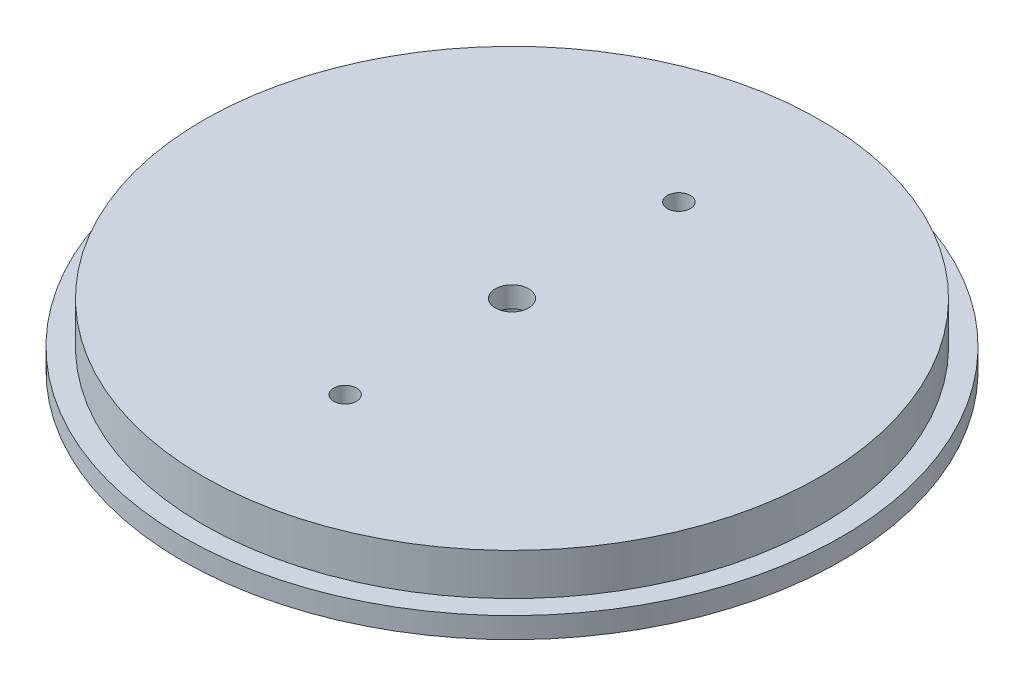
from build123d import *

# Parameters (mm, degrees)
SKETCH1_R           = 79
BOSS_EXTRUDE1_DEPTH = 5
SKETCH2_R           = 74
BOSS_EXTRUDE2_DEPTH = 10
SKETCH3_R           = 2.75
CUT_EXTRUDE1_DEPTH  = 113.725329895
SKETCH4_R           = 4
CUT_EXTRUDE2_DEPTH  = 5
SKETCH5_R           = 6
CUT_EXTRUDE3_DEPTH  = 10


with BuildPart() as part:
    # Sketch1 → Boss-Extrude1 (new body)
    with BuildSketch(Plane(origin=(0, 0, 0), x_dir=(1, 0, 0), z_dir=(0, 1, 0))):
        Circle(SKETCH1_R)
    extrude(amount=BOSS_EXTRUDE1_DEPTH)

    # Sketch2 → Boss-Extrude2 (add)
    with BuildSketch(Plane(origin=(0, 5, 0), x_dir=(1, 0, 0), z_dir=(0, 1, 0))):
        Circle(SKETCH2_R)
    extrude(amount=BOSS_EXTRUDE2_DEPTH)

    # Sketch3 → Cut-Extrude1 (cut, through all)
    with BuildSketch(Plane(origin=(0, 15, 0), x_dir=(1, 0, 0), z_dir=(0, 1, 0))):
        with Locations((0, 40)):
            Circle(SKETCH3_R)
        with Locations((0, -40)):
            Circle(SKETCH3_R)
    extrude(amount=-CUT_EXTRUDE1_DEPTH, mode=Mode.SUBTRACT)

    # Sketch4 → Cut-Extrude2 (cut)
    with BuildSketch(Plane(origin=(0, 15, 0), x_dir=(1, 0, 0), z_dir=(0, 1, 0))):
        Circle(SKETCH4_R)
    extrude(amount=-CUT_EXTRUDE2_DEPTH, mode=Mode.SUBTRACT)

    # Sketch5 → Cut-Extrude3 (cut)
    with BuildSketch(Plane.XZ):
        Circle(SKETCH5_R)
    extrude(amount=-CUT_EXTRUDE3_DEPTH, mode=Mode.SUBTRACT)


solid = part.part
